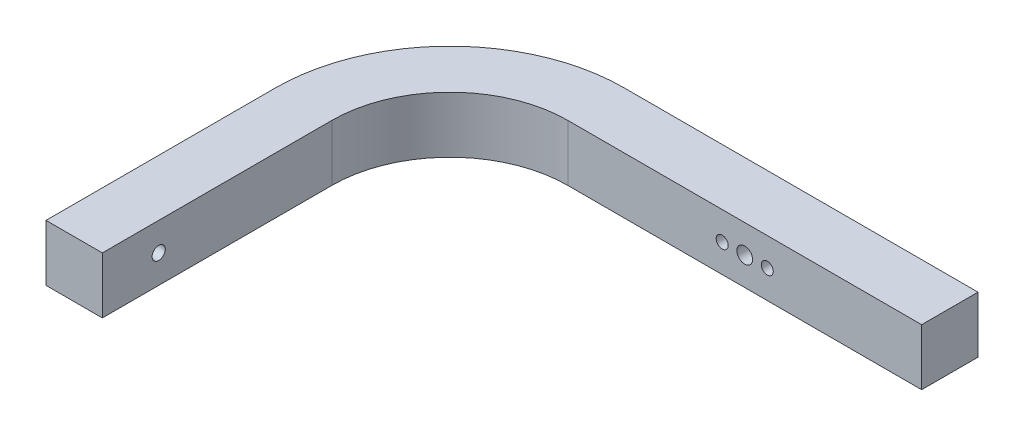
from build123d import *

# Parameters (mm, degrees)
BOSS_EXTRUDE1_DEPTH      = 7.5
BOSS_EXTRUDE1_DEPTH_BACK = 7.5
CUT_EXTRUDE1_DEPTH       = 166.492779299
CUT_EXTRUDE1_DEPTH_BACK  = 166.492779299
SKETCH2_R                = 1.75
SKETCH3_R                = 2.1
SKETCH3_R_2              = 1.6
CUT_EXTRUDE2_DEPTH       = 143.670073947
SKETCH4_R                = 2.275
CUT_EXTRUDE3_DEPTH       = 6
SKETCH5_R                = 3.825
CUT_EXTRUDE4_DEPTH       = 0.75


with BuildPart() as part:
    # Sketch1 → Boss-Extrude1 (new, two sides: drawn at the far end of the back side and taken through both)
    with BuildSketch(Plane(origin=(0, 0, 0), x_dir=(1, 0, 0), z_dir=(0, 1, 0)).offset(-BOSS_EXTRUDE1_DEPTH_BACK)):
        with BuildLine():
            Line((-47.1, 0), (47.1, 0))
            Line((47.1, 0), (47.1, -15))
            Line((47.1, -15), (-47.1, -15))
            ThreePointArc((-47.1, -15), (-69.303152929, -24.196847071), (-78.5, -46.4))
            Line((-78.5, -46.4), (-78.5, -107.5))
            Line((-78.5, -107.5), (-93.5, -107.5))
            Line((-93.5, -107.5), (-93.5, -46.4))
            ThreePointArc((-93.5, -46.4), (-79.909754647, -13.590245353), (-47.1, 0))
        make_face()
    extrude(amount=BOSS_EXTRUDE1_DEPTH + BOSS_EXTRUDE1_DEPTH_BACK)

    # Sketch2 → Cut-Extrude1 (cut, two sides: drawn at the far end of the back side and taken through both)
    with BuildSketch(Plane.ZY.offset(78.5).offset(-CUT_EXTRUDE1_DEPTH_BACK)):
        with Locations((92.5, 0)):
            Circle(SKETCH2_R)
    extrude(amount=CUT_EXTRUDE1_DEPTH + CUT_EXTRUDE1_DEPTH_BACK, mode=Mode.SUBTRACT)

    # Sketch3 → Cut-Extrude2 (cut, through all)
    with BuildSketch(Plane(origin=(0, 0, 0), x_dir=(-1, 0, 0), z_dir=(0, 0, -1))):
        Circle(SKETCH3_R)
        with Locations((-6, 0)):
            Circle(SKETCH3_R_2)
        with Locations((6, 0)):
            Circle(SKETCH3_R_2)
    extrude(amount=-CUT_EXTRUDE2_DEPTH, mode=Mode.SUBTRACT)

    # Sketch4 → Cut-Extrude3 (cut)
    with BuildSketch(Plane(origin=(-93.5, 0, 0), x_dir=(0, 0, -1), z_dir=(1, 0, 0))):
        with Locations((-92.5, 0)):
            Circle(SKETCH4_R)
    extrude(amount=CUT_EXTRUDE3_DEPTH, mode=Mode.SUBTRACT)

    # Sketch5 → Cut-Extrude4 (cut)
    with BuildSketch(Plane.ZY.offset(93.5)):
        with Locations((92.5, 0)):
            Circle(SKETCH5_R)
    extrude(amount=-CUT_EXTRUDE4_DEPTH, mode=Mode.SUBTRACT)


solid = part.part
